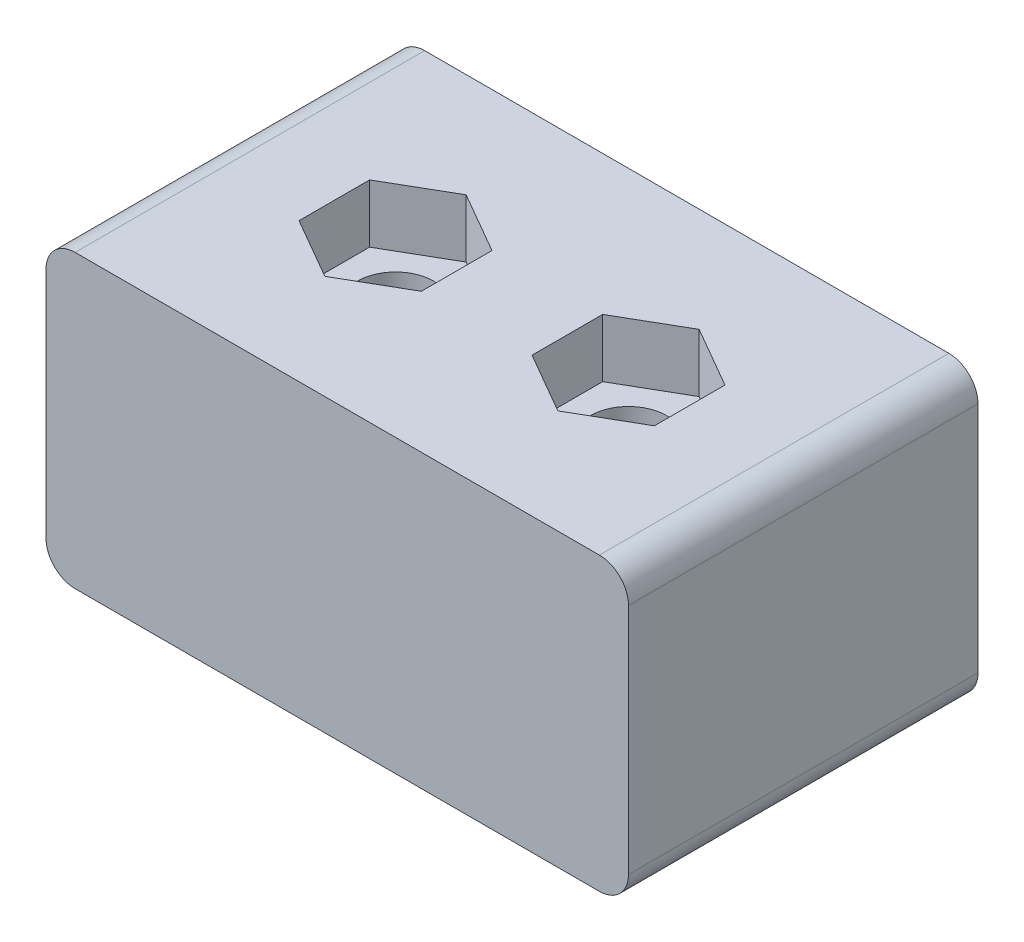
from build123d import *

# Parameters (mm, degrees)
BOSS_EXTRUDE1_DEPTH = 6
SKETCH2_R           = 1.3
CUT_EXTRUDE1_DEPTH  = 10
CUT_EXTRUDE2_DEPTH  = 2


with BuildPart() as part:
    # Sketch1 → Boss-Extrude1 (new, symmetric)
    with BuildSketch(Plane.XY):
        with BuildLine():
            Line((-9, 0), (9, 0))
            ThreePointArc((9, 0), (9.707106781, 0.292893219), (10, 1))
            Line((10, 1), (10, 9))
            ThreePointArc((10, 9), (9.707106781, 9.707106781), (9, 10))
            Line((9, 10), (-9, 10))
            ThreePointArc((-9, 10), (-9.707106781, 9.707106781), (-10, 9))
            Line((-10, 9), (-10, 1))
            ThreePointArc((-10, 1), (-9.707106781, 0.292893219), (-9, 0))
        make_face()
    extrude(amount=BOSS_EXTRUDE1_DEPTH, both=True)

    # Sketch2 → Cut-Extrude1 (cut)
    with BuildSketch(Plane(origin=(0, 0, 0), x_dir=(1, 0, 0), z_dir=(0, 1, 0))):
        with Locations((4, 0)):
            Circle(SKETCH2_R)
        with Locations((-4, 0)):
            Circle(SKETCH2_R)
    extrude(amount=CUT_EXTRUDE1_DEPTH, mode=Mode.SUBTRACT)

    # Sketch3 → Cut-Extrude2 (cut)
    with BuildSketch(Plane(origin=(0, 10, 0), x_dir=(1, 0, 0), z_dir=(0, 1, 0))):
        Polygon((6.1, -1.212435565), (4, -2.424871131), (1.9, -1.212435565), (1.9, 1.212435565), (4, 2.424871131), (6.1, 1.212435565), align=None)
        Polygon((-1.9, -1.212435565), (-4, -2.424871131), (-6.1, -1.212435565), (-6.1, 1.212435565), (-4, 2.424871131), (-1.9, 1.212435565), align=None)
    extrude(amount=-CUT_EXTRUDE2_DEPTH, mode=Mode.SUBTRACT)


solid = part.part
